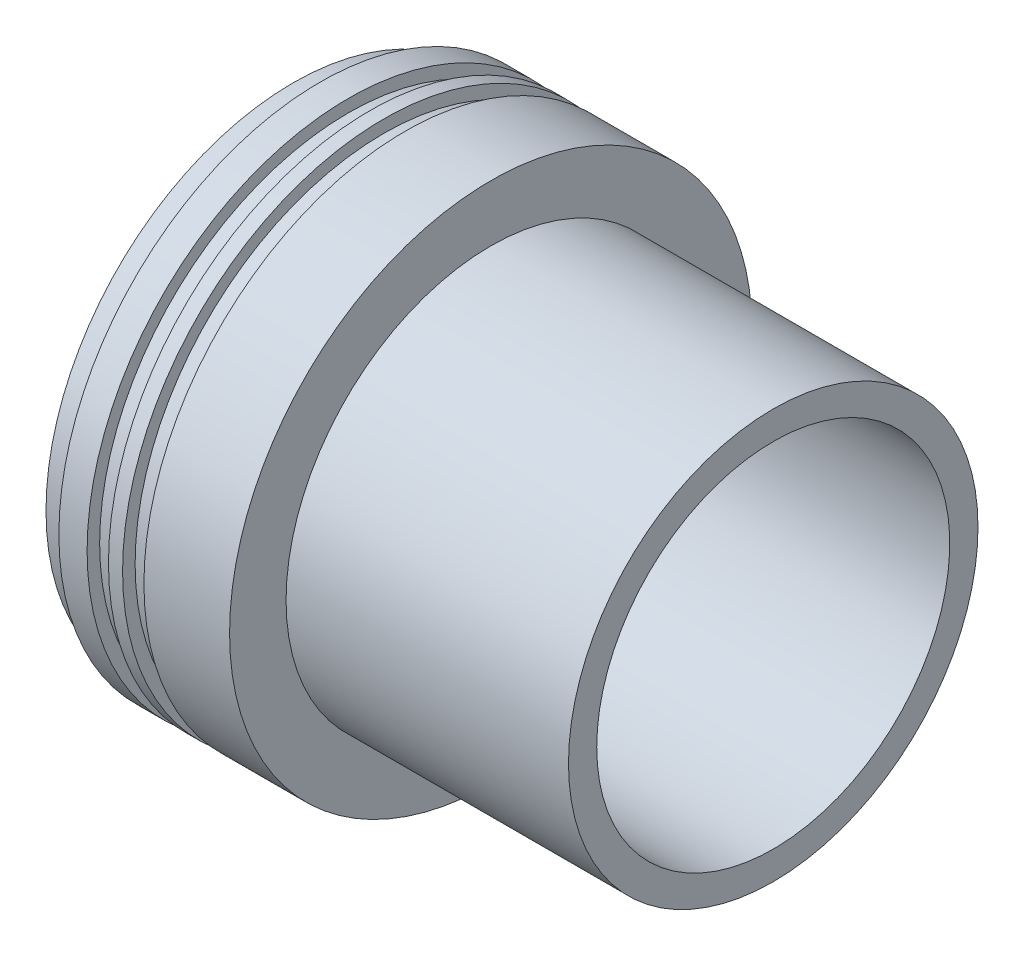
from build123d import *


with BuildPart() as part:
    # Sketch1 → Revolve1 (revolve)
    with BuildSketch(Plane.XY):
        with BuildLine():
            Line((0, 9.525), (0, 3.175))
            Line((0, 3.175), (6.06588874, 3.175))
            Line((6.06588874, 3.175), (6.06588874, 0))
            Line((6.06588874, 0), (12.41588874, 0))
            Line((12.41588874, 0), (12.41588874, 2.8194))
            Line((12.41588874, 2.8194), (17.21648874, 2.8194))
            Line((17.21648874, 2.8194), (17.21648874, 0))
            Line((17.21648874, 0), (20.39148874, 0))
            Line((20.39148874, 0), (20.39148874, 2.8194))
            Line((20.39148874, 2.8194), (25.19208874, 2.8194))
            Line((25.19208874, 2.8194), (25.19208874, 0))
            Line((25.19208874, 0), (44.45, 0))
            Line((44.45, 0), (44.45, 12.7))
            Line((44.45, 12.7), (107.95, 12.7))
            Line((107.95, 12.7), (107.95, 19.05))
            Line((107.95, 19.05), (37.555256121, 19.05))
            ThreePointArc((37.555256121, 19.05), (35.125216326, 18.566635031), (33.065128061, 17.190128061))
            Line((33.065128061, 17.190128061), (27.259871939, 11.384871939))
            ThreePointArc((27.259871939, 11.384871939), (25.199783674, 10.008364969), (22.769743879, 9.525))
            Line((22.769743879, 9.525), (0, 9.525))
        make_face()
    revolve(axis=Axis((0, 58.7375, 0), (1, 0, 0)))


solid = part.part
